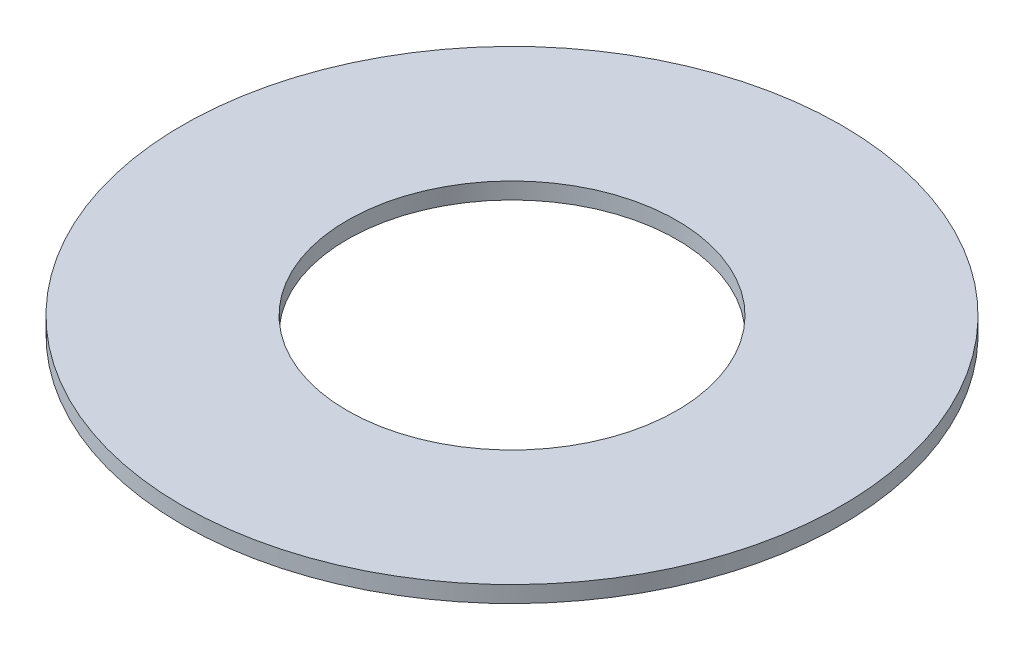
from build123d import *

# Parameters (mm, degrees)
SKETCH1_R           = 100
SKETCH1_R_2         = 50
BOSS_EXTRUDE1_DEPTH = 2.5


with BuildPart() as part:
    # Sketch1 → Boss-Extrude1 (new, symmetric)
    with BuildSketch(Plane(origin=(0, 0, 0), x_dir=(1, 0, 0), z_dir=(0, 1, 0))):
        Circle(SKETCH1_R)
        Circle(SKETCH1_R_2, mode=Mode.SUBTRACT)
    extrude(amount=BOSS_EXTRUDE1_DEPTH, both=True)


solid = part.part
